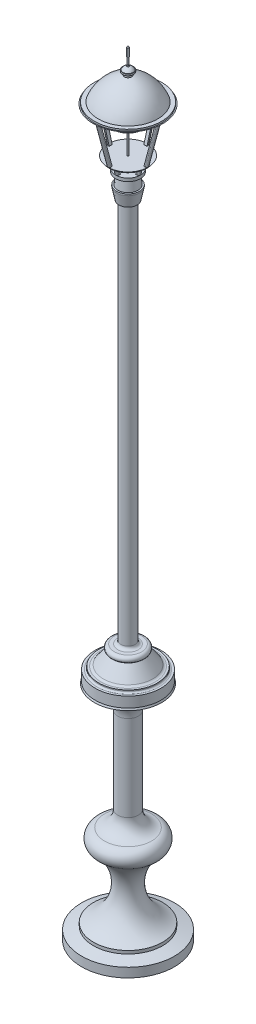
from build123d import *

# Parameters (mm, degrees)
SKETCH2_R           = 4
BOSS_EXTRUDE1_DEPTH = 1
BOSS_EXTRUDE2_DEPTH = 0.5
FILLET3_START       = 212.525187044
FILLET3_DEPTH       = 4.474812956
CIRPATTERN1_COUNT   = 4
BOSS_EXTRUDE4_DEPTH = 0.5
FILLET6_START       = 213.806892112
FILLET6_DEPTH       = 16.193107888
CIRPATTERN2_COUNT   = 4
SCALE2_SCALE        = 0.5
SCALE3_SCALE        = 0.8
SCALE4_SCALE        = 0.8
SCALE5_SCALE        = 0.8


with BuildPart() as part:
    # Sketch1 → Revolve1 (revolve)
    with BuildSketch(Plane.XY, mode=Mode.PRIVATE) as revolve1_sk:
        with BuildLine():
            Line((0, 0), (-15, 0))
            Line((-15, 0), (-15, 3))
            Line((-15, 3), (-11.171537248, 4))
            Line((-11.171537248, 4), (-11.171537248, 5))
            ThreePointArc((-11.171537248, 5), (-3.851964378, 14.927509458), (-8.850574954, 26.20339006))
            ThreePointArc((-8.850574954, 26.20339006), (-10.014556555, 29.300311241), (-7.62153283, 31.58487059))
            ThreePointArc((-7.62153283, 31.58487059), (-4.552574194, 33.367898218), (-3.341662981, 36.704271797))
            Line((-3.341662981, 36.704271797), (-3.341662981, 64.461749864))
            ThreePointArc((-3.341662981, 64.461749864), (-5.550208704, 69.793870953), (-10.882200885, 72.002727875))
            Line((-10.882200885, 72.002727875), (-10.651398991, 72.573132865))
            Line((-10.651398991, 72.573132865), (-10.651398991, 75.936339111))
            Line((-10.651398991, 75.936339111), (-9.977298462, 75.936339111))
            ThreePointArc((-9.977298462, 75.936339111), (-9.602531868, 76.091572516), (-9.447298462, 76.466339111))
            Line((-9.447298462, 76.466339111), (-9.447298462, 76.793156254))
            Line((-9.447298462, 76.793156254), (-8.802681153, 76.793156254))
            ThreePointArc((-8.802681153, 76.793156254), (-8.347407363, 76.902804764), (-7.991973758, 77.207704702))
            Line((-7.991973758, 77.207704702), (-5.064715999, 81.261241678))
            ThreePointArc((-5.064715999, 81.261241678), (-5.376499637, 82.371935954), (-4.434130367, 83.037361359))
            Line((-4.434130367, 83.037361359), (-3.300573645, 83.037361359))
            ThreePointArc((-3.300573645, 83.037361359), (-2.593466864, 83.330254578), (-2.300573645, 84.037361359))
            Line((-2.300573645, 84.037361359), (-2.300573645, 207.530880287))
            Line((-2.300573645, 207.530880287), (-2.960147899, 207.530880287))
            Line((-2.960147899, 207.530880287), (-3.729989331, 211.279283847))
            Line((-3.729989331, 211.279283847), (-3.729989331, 211.776517679))
            Line((-3.729989331, 211.776517679), (-3.236029518, 211.776517679))
            Line((-3.236029518, 211.776517679), (-2.889184881, 215.417079112))
            Line((-2.889184881, 215.417079112), (0, 215.417079112))
            Line((0, 215.417079112), (0, 0))
        make_face()
    revolve(revolve1_sk.sketch.rotate(Axis((0, 0, 0), (0, 1, 0)), 270), axis=Axis((0, 0, 0), (0, 1, 0)))

    # Sketch2 → Boss-Extrude1 (add)
    with BuildSketch(Plane(origin=(0, 215.417079112, 0), x_dir=(1, 0, 0), z_dir=(0, 1, 0))):
        with Locations(Location((0, 0, 0), (0, 0, 270))):
            Circle(SKETCH2_R)
    extrude(amount=BOSS_EXTRUDE1_DEPTH)


with BuildPart() as body_2:
    # Sketch3 → Boss-Extrude2 (new, symmetric)
    with BuildSketch(Plane(origin=(0, 0, 0), x_dir=(0, 0, -1), z_dir=(1, 0, 0))):
        Polygon((-4, 216.417079112), (-2.978785271, 216.417079112), (-3.600010595, 219.417079112), (-4.621225324, 219.417079112), align=None)
    extrude(amount=BOSS_EXTRUDE2_DEPTH, both=True)

    # Fillet3: read off the stored shape, not the designer's step
    # Fillet3 outline → Fillet3 (cut)
    with BuildSketch(Plane(origin=(0, 0, 0), x_dir=(1, 0, 0), z_dir=(0, 0.9792257149089403, 0.20277327057843406)).offset(FILLET3_START)):
        with BuildLine():
            Line((0.5, 39.966696081), (0.5, 40.466696081))
            ThreePointArc((0.5, 40.466696081), (0.353553391, 40.11314269), (0, 39.966696081))
            Line((0, 39.966696081), (0.5, 39.966696081))
        make_face()
        with BuildLine():
            Line((-0.5, 39.966696081), (0, 39.966696081))
            ThreePointArc((0, 39.966696081), (-0.353553391, 40.11314269), (-0.5, 40.466696081))
            Line((-0.5, 40.466696081), (-0.5, 39.966696081))
        make_face()
    extrude(amount=FILLET3_DEPTH, mode=Mode.SUBTRACT)


with BuildPart() as cirpattern1_1:
    # CirPattern1: pattern copy
    add(body_2.part.rotate(Axis((0, 0, 0), (0, 1, 0)), 1 * 360 / CIRPATTERN1_COUNT))


with BuildPart() as cirpattern1_2:
    # CirPattern1: pattern copy
    add(body_2.part.rotate(Axis((0, 0, 0), (0, 1, 0)), 2 * 360 / CIRPATTERN1_COUNT))


with BuildPart() as cirpattern1_3:
    # CirPattern1: pattern copy
    add(body_2.part.rotate(Axis((0, 0, 0), (0, 1, 0)), 3 * 360 / CIRPATTERN1_COUNT))


with BuildPart() as body_2_1:
    add(body_2.part)

    add(cirpattern1_1.part)  # Revolve2 merges CirPattern1_1

    add(cirpattern1_2.part)  # Revolve2 merges CirPattern1_2

    add(cirpattern1_3.part)  # Revolve2 merges CirPattern1_3
    # Sketch5 → Revolve2 (revolve)
    with BuildSketch(Plane.XY, mode=Mode.PRIVATE) as revolve2_sk:
        with BuildLine():
            Line((0, 219.417079112), (-6.134303085, 219.417079112))
            Line((-6.134303085, 219.417079112), (-6.525357278, 219.917079112))
            Line((-6.525357278, 219.917079112), (-0.25, 219.917079112))
            Line((-0.25, 219.917079112), (-0.25, 229.499335405))
            Line((-0.25, 229.499335405), (-4.711171069, 229.499335405))
            Line((-4.711171069, 229.499335405), (-4.70534422, 229.999301452))
            Line((-4.70534422, 229.999301452), (-1.020163974, 231.283365843))
            Line((-1.020163974, 231.283365843), (-1.020163974, 232.283365843))
            Line((-1.020163974, 232.283365843), (-9.264250991, 233.441626978))
            Line((-9.264250991, 233.441626978), (-9.629983506, 233.941626978))
            Line((-9.629983506, 233.941626978), (-10.303998398, 233.941626978))
            Line((-10.303998398, 233.941626978), (-11.239244366, 234.441626978))
            Line((-11.239244366, 234.441626978), (-10.900217703, 234.441626978))
            Line((-10.900217703, 234.441626978), (-10.900217703, 234.975491897))
            Line((-10.900217703, 234.975491897), (-9.629983506, 234.975491897))
            ThreePointArc((-9.629983506, 234.975491897), (-6.285788492, 239.758257917), (-1.134061741, 242.500192013))
            Line((-1.134061741, 242.500192013), (-1.134061741, 243.500192013))
            Line((-1.134061741, 243.500192013), (-1.77311388, 243.500192013))
            Line((-1.77311388, 243.500192013), (-1.77311388, 244.000192013))
            Line((-1.77311388, 244.000192013), (-1.612067551, 244.000192013))
            ThreePointArc((-1.612067551, 244.000192013), (-1.063676925, 244.629465444), (-0.304985725, 244.977466873))
            Line((-0.304985725, 244.977466873), (-0.304985725, 245.394225833))
            Line((-0.304985725, 245.394225833), (-0.200795985, 245.394225833))
            Line((-0.200795985, 245.394225833), (-0.200795985, 247.59151046))
            Line((-0.200795985, 247.59151046), (-0.295074341, 247.59151046))
            Line((-0.295074341, 247.59151046), (-0.295074341, 250.245436668))
            Line((-0.295074341, 250.245436668), (0, 250.614855446))
            Line((0, 250.614855446), (0, 219.417079112))
        make_face()
    revolve(revolve2_sk.sketch.rotate(Axis((0, 253.746079201, 0), (0, -1, 0)), 270), axis=Axis((0, 253.746079201, 0), (0, -1, 0)))


with BuildPart() as body_3:
    # Sketch6 → Boss-Extrude4 (new, symmetric)
    with BuildSketch(Plane(origin=(0, 0, 0), x_dir=(0, 0, -1), z_dir=(1, 0, 0))):
        Polygon((-10.303998398, 233.941626978), (-6.525357278, 219.917079112), (-5.620325127, 219.917079112), (-9.398966247, 233.941626978), align=None)
    extrude(amount=BOSS_EXTRUDE4_DEPTH, both=True)

    # Fillet6: read off the stored shape, not the designer's step
    # Fillet6 outline → Fillet6 (cut)
    with BuildSketch(Plane(origin=(0, 0, 0), x_dir=(1, 0, 0), z_dir=(0, 0.9655673258451928, 0.26015329953733696)).offset(FILLET6_START)):
        with BuildLine():
            Line((0.5, 50.911481979), (0.5, 51.411481979))
            ThreePointArc((0.5, 51.411481979), (0.353553391, 51.057928588), (0, 50.911481979))
            Line((0, 50.911481979), (0.5, 50.911481979))
        make_face()
        with BuildLine():
            Line((-0.5, 50.911481979), (0, 50.911481979))
            ThreePointArc((0, 50.911481979), (-0.353553391, 51.057928588), (-0.5, 51.411481979))
            Line((-0.5, 51.411481979), (-0.5, 50.911481979))
        make_face()
    extrude(amount=FILLET6_DEPTH, mode=Mode.SUBTRACT)


with BuildPart() as cirpattern2_1:
    # CirPattern2: pattern copy
    add(body_3.part.rotate(Axis((0, 0, 0), (0, 1, 0)), 1 * 360 / CIRPATTERN2_COUNT))


with BuildPart() as cirpattern2_2:
    # CirPattern2: pattern copy
    add(body_3.part.rotate(Axis((0, 0, 0), (0, 1, 0)), 2 * 360 / CIRPATTERN2_COUNT))


with BuildPart() as cirpattern2_3:
    # CirPattern2: pattern copy
    add(body_3.part.rotate(Axis((0, 0, 0), (0, 1, 0)), 3 * 360 / CIRPATTERN2_COUNT))


with BuildPart() as cirpattern2_1_1:
    # Scale2: scaled about (0, 0, 0)
    add(cirpattern2_1.part.scale(SCALE2_SCALE))


with BuildPart() as part_1:
    # Scale2: scaled about (0, 0, 0)
    add(part.part.scale(SCALE2_SCALE))


with BuildPart() as cirpattern2_2_1:
    # Scale2: scaled about (0, 0, 0)
    add(cirpattern2_2.part.scale(SCALE2_SCALE))


with BuildPart() as body_2_2:
    # Scale2: scaled about (0, 0, 0)
    add(body_2_1.part.scale(SCALE2_SCALE))


with BuildPart() as cirpattern2_3_1:
    # Scale2: scaled about (0, 0, 0)
    add(cirpattern2_3.part.scale(SCALE2_SCALE))


with BuildPart() as body_3_1:
    # Scale2: scaled about (0, 0, 0)
    add(body_3.part.scale(SCALE2_SCALE))


with BuildPart() as body_2_3:
    # Scale3: scaled about (0, 0, 0)
    add(body_2_2.part.scale(SCALE3_SCALE))


with BuildPart() as cirpattern2_1_2:
    # Scale3: scaled about (0, 0, 0)
    add(cirpattern2_1_1.part.scale(SCALE3_SCALE))


with BuildPart() as cirpattern2_3_2:
    # Scale3: scaled about (0, 0, 0)
    add(cirpattern2_3_1.part.scale(SCALE3_SCALE))


with BuildPart() as part_2:
    # Scale3: scaled about (0, 0, 0)
    add(part_1.part.scale(SCALE3_SCALE))


with BuildPart() as body_3_2:
    # Scale3: scaled about (0, 0, 0)
    add(body_3_1.part.scale(SCALE3_SCALE))


with BuildPart() as cirpattern2_2_2:
    # Scale3: scaled about (0, 0, 0)
    add(cirpattern2_2_1.part.scale(SCALE3_SCALE))


with BuildPart() as body_2_4:
    # Scale4: scaled about (0, 0, 0)
    add(body_2_3.part.scale(SCALE4_SCALE))


with BuildPart() as body_3_3:
    # Scale4: scaled about (0, 0, 0)
    add(body_3_2.part.scale(SCALE4_SCALE))


with BuildPart() as cirpattern2_2_3:
    # Scale4: scaled about (0, 0, 0)
    add(cirpattern2_2_2.part.scale(SCALE4_SCALE))


with BuildPart() as cirpattern2_1_3:
    # Scale4: scaled about (0, 0, 0)
    add(cirpattern2_1_2.part.scale(SCALE4_SCALE))


with BuildPart() as cirpattern2_3_3:
    # Scale4: scaled about (0, 0, 0)
    add(cirpattern2_3_2.part.scale(SCALE4_SCALE))


with BuildPart() as part_3:
    # Scale4: scaled about (0, 0, 0)
    add(part_2.part.scale(SCALE4_SCALE))


with BuildPart() as cirpattern2_2_4:
    # Scale5: scaled about (0, 0, 0)
    add(cirpattern2_2_3.part.scale(SCALE5_SCALE))


with BuildPart() as cirpattern2_1_4:
    # Scale5: scaled about (0, 0, 0)
    add(cirpattern2_1_3.part.scale(SCALE5_SCALE))


with BuildPart() as body_2_5:
    # Scale5: scaled about (0, 0, 0)
    add(body_2_4.part.scale(SCALE5_SCALE))


with BuildPart() as cirpattern2_3_4:
    # Scale5: scaled about (0, 0, 0)
    add(cirpattern2_3_3.part.scale(SCALE5_SCALE))


with BuildPart() as part_4:
    # Scale5: scaled about (0, 0, 0)
    add(part_3.part.scale(SCALE5_SCALE))


with BuildPart() as body_3_4:
    # Scale5: scaled about (0, 0, 0)
    add(body_3_3.part.scale(SCALE5_SCALE))


solid = Compound([cirpattern2_2_4.part, cirpattern2_1_4.part, body_2_5.part, cirpattern2_3_4.part, part_4.part, body_3_4.part])
